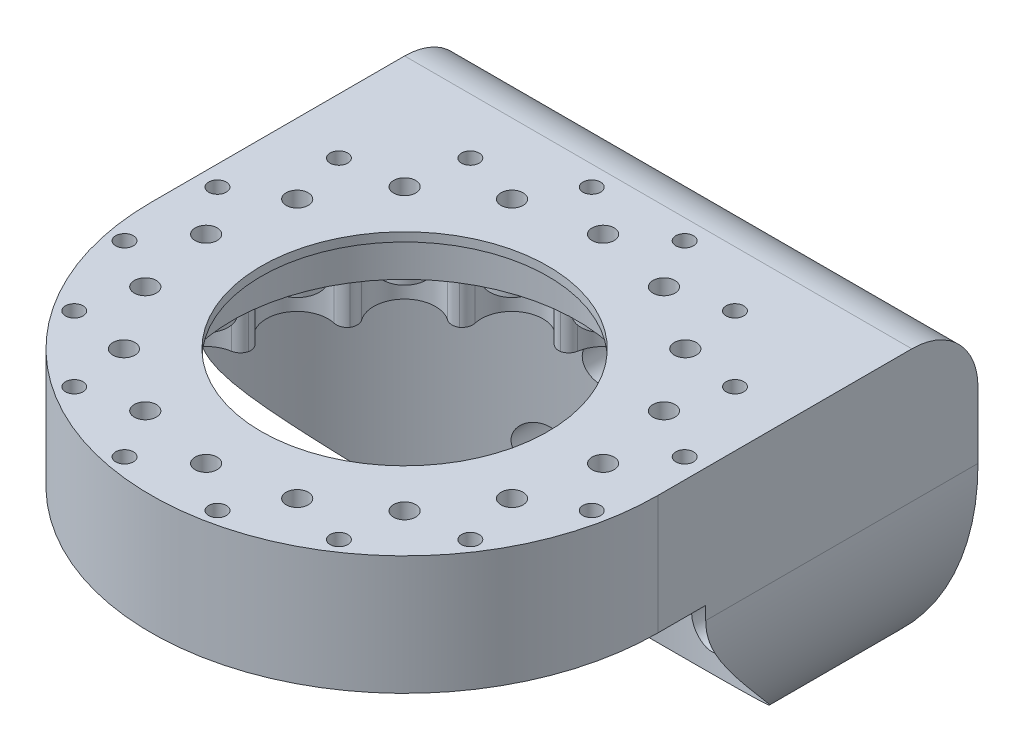
from build123d import *
from build123d.topology import SkipClean

# Parameters (mm, degrees)
SKETCH1_R           = 57.5
SKETCH1_R_2         = 39.1
SKETCH1_R_3         = 2
BOSS_EXTRUDE1_DEPTH = 14
SKETCH2_R           = 2.5
CUT_EXTRUDE1_DEPTH  = 40
SKETCH4_R           = 5
SKETCH4_R_2         = 2.5
BOSS_EXTRUDE3_DEPTH = 1.8
BOSS_EXTRUDE4_START = 13
SKETCH5_R           = 57.5
SKETCH5_R_2         = 2
BOSS_EXTRUDE4_DEPTH = 13
FILLET2_R           = 2.5
BOSS_EXTRUDE7_DEPTH = 27
BOSS_EXTRUDE8_DEPTH = 115
CUT_EXTRUDE2_START  = -60.5
SKETCH8_R           = 58.5
CUT_EXTRUDE2_DEPTH  = 60.5
SKETCH9_R           = 2.25
CUT_EXTRUDE3_DEPTH  = 67.5
SKETCH10_R          = 4.5
CUT_EXTRUDE4_DEPTH  = 62.5
CUT_EXTRUDE5_DEPTH  = 133
FILLET4_R           = 15
BOSS_EXTRUDE9_START = -2
SKETCH12_R          = 39.1
SKETCH12_R_2        = 32.5
BOSS_EXTRUDE9_DEPTH = 2


with BuildPart() as part:
    # Sketch1 → Boss-Extrude1 (new body)
    with BuildSketch(Plane(origin=(0, 0, 0), x_dir=(1, 0, 0), z_dir=(0, 1, 0))):
        with Locations(Location((0, 0, 0), (0, 0, 270))):
            Circle(SKETCH1_R)
        with Locations(Location((0, 0, 0), (0, 0, 270))):
            Circle(SKETCH1_R_2, mode=Mode.SUBTRACT)
        with Locations(Location((-10.534877389, 52.962405142, 0), (0, 0, 270))):
            Circle(SKETCH1_R_3, mode=Mode.SUBTRACT)
        with Locations(Location((10.534877389, 52.962405142, 0), (0, 0, 270))):
            Circle(SKETCH1_R_3, mode=Mode.SUBTRACT)
        with Locations(Location((30.000792583, 44.899359064, 0), (0, 0, 270))):
            Circle(SKETCH1_R_3, mode=Mode.SUBTRACT)
        with Locations(Location((44.899359064, 30.000792583, 0), (0, 0, 270))):
            Circle(SKETCH1_R_3, mode=Mode.SUBTRACT)
        with Locations(Location((52.962405142, 10.534877389, 0), (0, 0, 270))):
            Circle(SKETCH1_R_3, mode=Mode.SUBTRACT)
        with Locations(Location((52.962405142, -10.534877389, 0), (0, 0, 270))):
            Circle(SKETCH1_R_3, mode=Mode.SUBTRACT)
        with Locations(Location((44.899359064, -30.000792583, 0), (0, 0, 270))):
            Circle(SKETCH1_R_3, mode=Mode.SUBTRACT)
        with Locations(Location((30.000792583, -44.899359064, 0), (0, 0, 270))):
            Circle(SKETCH1_R_3, mode=Mode.SUBTRACT)
        with Locations(Location((10.534877389, -52.962405142, 0), (0, 0, 270))):
            Circle(SKETCH1_R_3, mode=Mode.SUBTRACT)
        with Locations(Location((-10.534877389, -52.962405142, 0), (0, 0, 270))):
            Circle(SKETCH1_R_3, mode=Mode.SUBTRACT)
        with Locations(Location((-30.000792583, -44.899359064, 0), (0, 0, 270))):
            Circle(SKETCH1_R_3, mode=Mode.SUBTRACT)
        with Locations(Location((-44.899359064, -30.000792583, 0), (0, 0, 270))):
            Circle(SKETCH1_R_3, mode=Mode.SUBTRACT)
        with Locations(Location((-52.962405142, -10.534877389, 0), (0, 0, 270))):
            Circle(SKETCH1_R_3, mode=Mode.SUBTRACT)
        with Locations(Location((-52.962405142, 10.534877389, 0), (0, 0, 270))):
            Circle(SKETCH1_R_3, mode=Mode.SUBTRACT)
        with Locations(Location((-44.899359064, 30.000792583, 0), (0, 0, 270))):
            Circle(SKETCH1_R_3, mode=Mode.SUBTRACT)
        with Locations(Location((-30.000792583, 44.899359064, 0), (0, 0, 270))):
            Circle(SKETCH1_R_3, mode=Mode.SUBTRACT)
    extrude(amount=BOSS_EXTRUDE1_DEPTH)

    # Sketch2 → Cut-Extrude1 (cut)
    with BuildSketch(Plane(origin=(0, 14, 0), x_dir=(1, 0, 0), z_dir=(0, 1, 0))):
        with Locations(Location((0, 45, 0), (0, 0, 270))):
            Circle(SKETCH2_R)
        with Locations(Location((17.220754456, 41.574578963, 0), (0, 0, 270))):
            Circle(SKETCH2_R)
        with Locations(Location((31.819805153, 31.819805153, 0), (0, 0, 270))):
            Circle(SKETCH2_R)
        with Locations(Location((41.574578963, 17.220754456, 0), (0, 0, 270))):
            Circle(SKETCH2_R)
        with Locations(Location((45, 0, 0), (0, 0, 270))):
            Circle(SKETCH2_R)
        with Locations(Location((41.574578963, -17.220754456, 0), (0, 0, 270))):
            Circle(SKETCH2_R)
        with Locations(Location((31.819805153, -31.819805153, 0), (0, 0, 270))):
            Circle(SKETCH2_R)
        with Locations(Location((17.220754456, -41.574578963, 0), (0, 0, 270))):
            Circle(SKETCH2_R)
        with Locations(Location((0, -45, 0), (0, 0, 270))):
            Circle(SKETCH2_R)
        with Locations(Location((-17.220754456, -41.574578963, 0), (0, 0, 270))):
            Circle(SKETCH2_R)
        with Locations(Location((-31.819805153, -31.819805153, 0), (0, 0, 270))):
            Circle(SKETCH2_R)
        with Locations(Location((-41.574578963, -17.220754456, 0), (0, 0, 270))):
            Circle(SKETCH2_R)
        with Locations(Location((-45, 0, 0), (0, 0, 270))):
            Circle(SKETCH2_R)
        with Locations(Location((-41.574578963, 17.220754456, 0), (0, 0, 270))):
            Circle(SKETCH2_R)
        with Locations(Location((-31.819805153, 31.819805153, 0), (0, 0, 270))):
            Circle(SKETCH2_R)
        with Locations(Location((-17.220754456, 41.574578963, 0), (0, 0, 270))):
            Circle(SKETCH2_R)
    extrude(amount=-CUT_EXTRUDE1_DEPTH, mode=Mode.SUBTRACT)

    # Sketch4 → Boss-Extrude3 (add)
    # profile 1 of 16: a face of its own
    with BuildSketch(Plane(origin=(0, 0, 0), x_dir=(1, 0, 0), z_dir=(0, 1, 0))):
        with Locations(Location((0, 45, 0), (0, 0, 270))):
            Circle(SKETCH4_R)
        with Locations(Location((0, 45, 0), (0, 0, 270))):
            Circle(SKETCH4_R_2, mode=Mode.SUBTRACT)
    # profile 2 of 16: a face of its own
    with BuildSketch(Plane(origin=(0, 0, 0), x_dir=(1, 0, 0), z_dir=(0, 1, 0))):
        with Locations(Location((17.220754456, 41.574578963, 0), (0, 0, 270))):
            Circle(SKETCH4_R)
        with Locations(Location((17.220754456, 41.574578963, 0), (0, 0, 270))):
            Circle(SKETCH4_R_2, mode=Mode.SUBTRACT)
    # profile 3 of 16: a face of its own
    with BuildSketch(Plane(origin=(0, 0, 0), x_dir=(1, 0, 0), z_dir=(0, 1, 0))):
        with Locations(Location((31.819805153, 31.819805153, 0), (0, 0, 270))):
            Circle(SKETCH4_R)
        with Locations(Location((31.819805153, 31.819805153, 0), (0, 0, 270))):
            Circle(SKETCH4_R_2, mode=Mode.SUBTRACT)
    # profile 4 of 16: a face of its own
    with BuildSketch(Plane(origin=(0, 0, 0), x_dir=(1, 0, 0), z_dir=(0, 1, 0))):
        with Locations(Location((41.574578963, 17.220754456, 0), (0, 0, 270))):
            Circle(SKETCH4_R)
        with Locations(Location((41.574578963, 17.220754456, 0), (0, 0, 270))):
            Circle(SKETCH4_R_2, mode=Mode.SUBTRACT)
    # profile 5 of 16: a face of its own
    with BuildSketch(Plane(origin=(0, 0, 0), x_dir=(1, 0, 0), z_dir=(0, 1, 0))):
        with Locations(Location((45, 0, 0), (0, 0, 270))):
            Circle(SKETCH4_R)
        with Locations(Location((45, 0, 0), (0, 0, 270))):
            Circle(SKETCH4_R_2, mode=Mode.SUBTRACT)
    # profile 6 of 16: a face of its own
    with BuildSketch(Plane(origin=(0, 0, 0), x_dir=(1, 0, 0), z_dir=(0, 1, 0))):
        with Locations(Location((41.574578963, -17.220754456, 0), (0, 0, 270))):
            Circle(SKETCH4_R)
        with Locations(Location((41.574578963, -17.220754456, 0), (0, 0, 270))):
            Circle(SKETCH4_R_2, mode=Mode.SUBTRACT)
    # profile 7 of 16: a face of its own
    with BuildSketch(Plane(origin=(0, 0, 0), x_dir=(1, 0, 0), z_dir=(0, 1, 0))):
        with Locations(Location((31.819805153, -31.819805153, 0), (0, 0, 270))):
            Circle(SKETCH4_R)
        with Locations(Location((31.819805153, -31.819805153, 0), (0, 0, 270))):
            Circle(SKETCH4_R_2, mode=Mode.SUBTRACT)
    # profile 8 of 16: a face of its own
    with BuildSketch(Plane(origin=(0, 0, 0), x_dir=(1, 0, 0), z_dir=(0, 1, 0))):
        with Locations(Location((17.220754456, -41.574578963, 0), (0, 0, 270))):
            Circle(SKETCH4_R)
        with Locations(Location((17.220754456, -41.574578963, 0), (0, 0, 270))):
            Circle(SKETCH4_R_2, mode=Mode.SUBTRACT)
    # profile 9 of 16: a face of its own
    with BuildSketch(Plane(origin=(0, 0, 0), x_dir=(1, 0, 0), z_dir=(0, 1, 0))):
        with Locations(Location((0, -45, 0), (0, 0, 270))):
            Circle(SKETCH4_R)
        with Locations(Location((0, -45, 0), (0, 0, 270))):
            Circle(SKETCH4_R_2, mode=Mode.SUBTRACT)
    # profile 10 of 16: a face of its own
    with BuildSketch(Plane(origin=(0, 0, 0), x_dir=(1, 0, 0), z_dir=(0, 1, 0))):
        with Locations(Location((-17.220754456, -41.574578963, 0), (0, 0, 270))):
            Circle(SKETCH4_R)
        with Locations(Location((-17.220754456, -41.574578963, 0), (0, 0, 270))):
            Circle(SKETCH4_R_2, mode=Mode.SUBTRACT)
    # profile 11 of 16: a face of its own
    with BuildSketch(Plane(origin=(0, 0, 0), x_dir=(1, 0, 0), z_dir=(0, 1, 0))):
        with Locations(Location((-31.819805153, -31.819805153, 0), (0, 0, 270))):
            Circle(SKETCH4_R)
        with Locations(Location((-31.819805153, -31.819805153, 0), (0, 0, 270))):
            Circle(SKETCH4_R_2, mode=Mode.SUBTRACT)
    # profile 12 of 16: a face of its own
    with BuildSketch(Plane(origin=(0, 0, 0), x_dir=(1, 0, 0), z_dir=(0, 1, 0))):
        with Locations(Location((-41.574578963, -17.220754456, 0), (0, 0, 270))):
            Circle(SKETCH4_R)
        with Locations(Location((-41.574578963, -17.220754456, 0), (0, 0, 270))):
            Circle(SKETCH4_R_2, mode=Mode.SUBTRACT)
    # profile 13 of 16: a face of its own
    with BuildSketch(Plane(origin=(0, 0, 0), x_dir=(1, 0, 0), z_dir=(0, 1, 0))):
        with Locations(Location((-45, 0, 0), (0, 0, 270))):
            Circle(SKETCH4_R)
        with Locations(Location((-45, 0, 0), (0, 0, 270))):
            Circle(SKETCH4_R_2, mode=Mode.SUBTRACT)
    # profile 14 of 16: a face of its own
    with BuildSketch(Plane(origin=(0, 0, 0), x_dir=(1, 0, 0), z_dir=(0, 1, 0))):
        with Locations(Location((-41.574578963, 17.220754456, 0), (0, 0, 270))):
            Circle(SKETCH4_R)
        with Locations(Location((-41.574578963, 17.220754456, 0), (0, 0, 270))):
            Circle(SKETCH4_R_2, mode=Mode.SUBTRACT)
    # profile 15 of 16: a face of its own
    with BuildSketch(Plane(origin=(0, 0, 0), x_dir=(1, 0, 0), z_dir=(0, 1, 0))):
        with Locations(Location((-31.819805153, 31.819805153, 0), (0, 0, 270))):
            Circle(SKETCH4_R)
        with Locations(Location((-31.819805153, 31.819805153, 0), (0, 0, 270))):
            Circle(SKETCH4_R_2, mode=Mode.SUBTRACT)
    # profile 16 of 16: a face of its own
    with BuildSketch(Plane(origin=(0, 0, 0), x_dir=(1, 0, 0), z_dir=(0, 1, 0))):
        with Locations(Location((-17.220754456, 41.574578963, 0), (0, 0, 270))):
            Circle(SKETCH4_R)
        with Locations(Location((-17.220754456, 41.574578963, 0), (0, 0, 270))):
            Circle(SKETCH4_R_2, mode=Mode.SUBTRACT)
    extrude(amount=-BOSS_EXTRUDE3_DEPTH)

    # Sketch5 → Boss-Extrude4 (add)
    with BuildSketch(Plane.XZ.offset(BOSS_EXTRUDE4_START)):
        with Locations(Location((0, 0, 0), (0, 0, 270))):
            Circle(SKETCH5_R)
        with Locations(Location((-30.000792583, -44.899359064, 0), (0, 0, 270))):
            Circle(SKETCH5_R_2, mode=Mode.SUBTRACT)
        with Locations(Location((-44.899359064, -30.000792583, 0), (0, 0, 270))):
            Circle(SKETCH5_R_2, mode=Mode.SUBTRACT)
        with Locations(Location((-10.534877389, -52.962405142, 0), (0, 0, 270))):
            Circle(SKETCH5_R_2, mode=Mode.SUBTRACT)
        with Locations(Location((-52.962405142, -10.534877389, 0), (0, 0, 270))):
            Circle(SKETCH5_R_2, mode=Mode.SUBTRACT)
        with Locations(Location((10.534877389, -52.962405142, 0), (0, 0, 270))):
            Circle(SKETCH5_R_2, mode=Mode.SUBTRACT)
        with Locations(Location((30.000792583, -44.899359064, 0), (0, 0, 270))):
            Circle(SKETCH5_R_2, mode=Mode.SUBTRACT)
        with Locations(Location((44.899359064, -30.000792583, 0), (0, 0, 270))):
            Circle(SKETCH5_R_2, mode=Mode.SUBTRACT)
        with BuildLine():
            ThreePointArc((43.742247125, 10.564838686), (44.135337618, 8.779064491), (44.455555556, 6.978795043))
            ThreePointArc((44.455555556, 6.978795043), (49.753361384, 5.138633627), (52, 0))
            ThreePointArc((52, 0), (49.753361384, -5.138633627), (44.455555556, -6.978795043))
            ThreePointArc((44.455555556, -6.978795043), (44.135337618, -8.779064491), (43.742247125, -10.564838686))
            ThreePointArc((43.742247125, -10.564838686), (47.23910353, -13.108193036), (48.574578963, -17.220754456))
            ThreePointArc((48.574578963, -17.220754456), (45.234108152, -23.187985482), (38.400908644, -23.459970489))
            ThreePointArc((38.400908644, -23.459970489), (37.416132554, -25.000660486), (36.369578094, -26.500071496))
            ThreePointArc((36.369578094, -26.500071496), (38.177808401, -28.89135937), (38.819805153, -31.819805153))
            ThreePointArc((38.819805153, -31.819805153), (34.244868492, -38.386316236), (26.500071496, -36.369578094))
            ThreePointArc((26.500071496, -36.369578094), (25.000660486, -37.416132554), (23.459970489, -38.400908644))
            ThreePointArc((23.459970489, -38.400908644), (24.027901885, -39.942787345), (24.220754456, -41.574578963))
            ThreePointArc((24.220754456, -41.574578963), (18.318158122, -48.488022764), (10.564838686, -43.742247125))
            ThreePointArc((10.564838686, -43.742247125), (8.779064491, -44.135337618), (6.978795043, -44.455555556))
            ThreePointArc((6.978795043, -44.455555556), (6.994696752, -44.727571384), (7, -45))
            ThreePointArc((7, -45), (-0.272428616, -51.994696752), (-6.978795043, -44.455555556))
            ThreePointArc((-6.978795043, -44.455555556), (-8.779064491, -44.135337618), (-10.564838686, -43.742247125))
            ThreePointArc((-10.564838686, -43.742247125), (-19.899538483, -48.041735691), (-23.459970489, -38.400908644))
            ThreePointArc((-23.459970489, -38.400908644), (-25.000660486, -37.416132554), (-26.500071496, -36.369578094))
            ThreePointArc((-26.500071496, -36.369578094), (-36.769552622, -36.769552622), (-36.369578094, -26.500071496))
            ThreePointArc((-36.369578094, -26.500071496), (-37.416132554, -25.000660486), (-38.400908644, -23.459970489))
            ThreePointArc((-38.400908644, -23.459970489), (-48.041735691, -19.899538483), (-43.742247125, -10.564838686))
            ThreePointArc((-43.742247125, -10.564838686), (-44.135337618, -8.779064491), (-44.455555556, -6.978795043))
            ThreePointArc((-44.455555556, -6.978795043), (-52, 0), (-44.455555556, 6.978795043))
            ThreePointArc((-44.455555556, 6.978795043), (-44.135337618, 8.779064491), (-43.742247125, 10.564838686))
            ThreePointArc((-43.742247125, 10.564838686), (-48.041735691, 19.899538483), (-38.400908644, 23.459970489))
            ThreePointArc((-38.400908644, 23.459970489), (-37.416132554, 25.000660486), (-36.369578094, 26.500071496))
            ThreePointArc((-36.369578094, 26.500071496), (-36.769552622, 36.769552622), (-26.500071496, 36.369578094))
            ThreePointArc((-26.500071496, 36.369578094), (-25.000660486, 37.416132554), (-23.459970489, 38.400908644))
            ThreePointArc((-23.459970489, 38.400908644), (-19.899538483, 48.041735691), (-10.564838686, 43.742247125))
            ThreePointArc((-10.564838686, 43.742247125), (-8.779064491, 44.135337618), (-6.978795043, 44.455555556))
            ThreePointArc((-6.978795043, 44.455555556), (-0.272428616, 51.994696752), (7, 45))
            ThreePointArc((7, 45), (6.994696752, 44.727571384), (6.978795043, 44.455555556))
            ThreePointArc((6.978795043, 44.455555556), (8.779064491, 44.135337618), (10.564838686, 43.742247125))
            ThreePointArc((10.564838686, 43.742247125), (18.318158122, 48.488022764), (24.220754456, 41.574578963))
            ThreePointArc((24.220754456, 41.574578963), (24.027901885, 39.942787345), (23.459970489, 38.400908644))
            ThreePointArc((23.459970489, 38.400908644), (25.000660486, 37.416132554), (26.500071496, 36.369578094))
            ThreePointArc((26.500071496, 36.369578094), (34.244868492, 38.386316236), (38.819805153, 31.819805153))
            ThreePointArc((38.819805153, 31.819805153), (38.177808401, 28.89135937), (36.369578094, 26.500071496))
            ThreePointArc((36.369578094, 26.500071496), (37.416132554, 25.000660486), (38.400908644, 23.459970489))
            ThreePointArc((38.400908644, 23.459970489), (45.234108152, 23.187985482), (48.574578963, 17.220754456))
            ThreePointArc((48.574578963, 17.220754456), (47.23910353, 13.108193036), (43.742247125, 10.564838686))
        make_face(mode=Mode.SUBTRACT)
        with Locations(Location((52.962405142, -10.534877389, 0), (0, 0, 270))):
            Circle(SKETCH5_R_2, mode=Mode.SUBTRACT)
        with Locations(Location((-52.962405142, 10.534877389, 0), (0, 0, 270))):
            Circle(SKETCH5_R_2, mode=Mode.SUBTRACT)
        with Locations(Location((-44.899359064, 30.000792583, 0), (0, 0, 270))):
            Circle(SKETCH5_R_2, mode=Mode.SUBTRACT)
        with Locations(Location((-30.000792583, 44.899359064, 0), (0, 0, 270))):
            Circle(SKETCH5_R_2, mode=Mode.SUBTRACT)
        with Locations(Location((-10.534877389, 52.962405142, 0), (0, 0, 270))):
            Circle(SKETCH5_R_2, mode=Mode.SUBTRACT)
        with Locations(Location((52.962405142, 10.534877389, 0), (0, 0, 270))):
            Circle(SKETCH5_R_2, mode=Mode.SUBTRACT)
        with Locations(Location((10.534877389, 52.962405142, 0), (0, 0, 270))):
            Circle(SKETCH5_R_2, mode=Mode.SUBTRACT)
        with Locations(Location((44.899359064, 30.000792583, 0), (0, 0, 270))):
            Circle(SKETCH5_R_2, mode=Mode.SUBTRACT)
        with Locations(Location((30.000792583, 44.899359064, 0), (0, 0, 270))):
            Circle(SKETCH5_R_2, mode=Mode.SUBTRACT)
    extrude(amount=-BOSS_EXTRUDE4_DEPTH)

    # Fillet2
    # the kernel refuses this fillet: 2.5 mm, written as the material it takes off along each edge
    with BuildSketch(Plane(origin=(-23.459970489, -17.820377086, -38.400908644), x_dir=(-0.3417635000019396, 0, -0.9397859916312991), z_dir=(0, 1, 0)), Plane(origin=(-6.978795043, -17.820377086, -44.455555556), x_dir=(0.043892226354758646, 0, -0.9990362718468347), z_dir=(0, 1, 0)), Plane(origin=(10.564838686, -17.820377086, -43.742247125), x_dir=(0.42286575913303964, 0, -0.9061923359601086), z_dir=(0, 1, 0)), Plane(origin=(26.500071496, -17.820377086, -36.369578094), x_dir=(0.7374618133709678, 0, -0.6753888315774875), z_dir=(0, 1, 0)), Plane(origin=(38.400908644, -17.820377086, -23.459970489), x_dir=(0.9397859916312004, 0, -0.341763500002211), z_dir=(0, 1, 0)), Plane(origin=(44.455555556, -17.820377086, -6.978795043), x_dir=(0.9990362718468425, 0, 0.04389222635458014), z_dir=(0, 1, 0)), Plane(origin=(43.742247125, -17.820377086, 10.564838686), x_dir=(0.906192335960156, 0, 0.4228657591329378), z_dir=(0, 1, 0)), Plane(origin=(-43.742247125, -17.820377086, -10.564838686), x_dir=(-0.906192335959984, 0, -0.4228657591333062), z_dir=(0, 1, 0)), Plane(origin=(-44.455555556, -17.820377086, 6.978795043), x_dir=(-0.9990362718468232, 0, -0.04389222635502207), z_dir=(0, 1, 0)), Plane(origin=(-38.400908644, -17.820377086, 23.459970489), x_dir=(-0.9397859916313415, 0, 0.34176350000182304), z_dir=(0, 1, 0)), Plane(origin=(-26.500071496, -17.820377086, 36.369578094), x_dir=(-0.7374618133711829, 0, 0.6753888315772527), z_dir=(0, 1, 0)), Plane(origin=(-10.564838686, -17.820377086, 43.742247125), x_dir=(-0.4228657591331182, 0, 0.9061923359600719), z_dir=(0, 1, 0)), Plane(origin=(6.978795043, -17.820377086, 44.455555556), x_dir=(-0.04389222635481192, 0, 0.9990362718468324), z_dir=(0, 1, 0)), Plane(origin=(23.459970489, -17.820377086, 38.400908644), x_dir=(0.34176350000200806, 0, 0.9397859916312743), z_dir=(0, 1, 0)), Plane(origin=(36.369578094, -17.820377086, 26.500071496), x_dir=(0.6753888315774799, 0, 0.7374618133709748), z_dir=(0, 1, 0))) as fillet2_piece_1:
        with BuildLine():
            CenterArc((2.004124414, 2.481490179), FILLET2_R, 193.892520635, 69.130988159)
            ThreePointArc((-0.422745168, 1.881236871), (-0.201295571, 0.942882908), (0, 0))
            ThreePointArc((0, 0), (0.8502346, 0.051827497), (1.700469199, 0))
        make_face()
    extrude(amount=17.820377086, mode=Mode.SUBTRACT)
    with BuildSketch(Plane(origin=(-10.564838686, -17.820377086, -43.742247125), x_dir=(0.9768566115091916, 0, -0.21389520927496325), z_dir=(0, 1, 0)), Plane(origin=(-26.500071496, -17.820377086, -36.369578094), x_dir=(0.8206436767198755, 0, -0.5714402469722311), z_dir=(0, 1, 0)), Plane(origin=(6.978795043, -17.820377086, -44.455555556), x_dir=(0.9843519824234629, 0, 0.17621343506951645), z_dir=(0, 1, 0)), Plane(origin=(23.459970489, -17.820377086, -38.400908644), x_dir=(0.8419886871867125, 0, 0.5394951813034075), z_dir=(0, 1, 0)), Plane(origin=(36.369578094, -17.820377086, -26.500071496), x_dir=(0.5714402469722466, 0, 0.8206436767198647), z_dir=(0, 1, 0)), Plane(origin=(43.742247125, -17.820377086, -10.564838686), x_dir=(0.21389520927503133, 0, 0.9768566115091767), z_dir=(0, 1, 0)), Plane(origin=(44.455555556, -17.820377086, 6.978795043), x_dir=(-0.176213435069412, 0, 0.9843519824234815), z_dir=(0, 1, 0)), Plane(origin=(38.400908644, -17.820377086, 23.459970489), x_dir=(-0.5394951813033152, 0, 0.8419886871867717), z_dir=(0, 1, 0)), Plane(origin=(-38.400908644, -17.820377086, -23.459970489), x_dir=(0.5394951813033921, 0, -0.8419886871867223), z_dir=(0, 1, 0)), Plane(origin=(-44.455555556, -17.820377086, -6.978795043), x_dir=(0.17621343506945097, 0, -0.9843519824234747), z_dir=(0, 1, 0)), Plane(origin=(-43.742247125, -17.820377086, 10.564838686), x_dir=(-0.21389520927505185, 0, -0.9768566115091721), z_dir=(0, 1, 0)), Plane(origin=(-36.369578094, -17.820377086, 26.500071496), x_dir=(-0.5714402469723276, 0, -0.8206436767198083), z_dir=(0, 1, 0)), Plane(origin=(-23.459970489, -17.820377086, 38.400908644), x_dir=(-0.8419886871868045, 0, -0.5394951813032637), z_dir=(0, 1, 0)), Plane(origin=(-6.978795043, -17.820377086, 44.455555556), x_dir=(-0.9843519824234938, 0, -0.17621343506934395), z_dir=(0, 1, 0)), Plane(origin=(10.564838686, -17.820377086, 43.742247125), x_dir=(-0.9768566115091561, 0, 0.21389520927512493), z_dir=(0, 1, 0)), Plane(origin=(26.500071496, -17.820377086, 36.369578094), x_dir=(-0.8206436767197927, 0, 0.57144024697235), z_dir=(0, 1, 0))) as fillet2_piece_2:
        with BuildLine():
            CenterArc((1.98171058, 2.499426205), FILLET2_R, 199.641418976, 69.130988159)
            ThreePointArc((-0.372826194, 1.659094972), (-0.135846618, 0.840910614), (0, 0))
            ThreePointArc((0, 0), (0.964075417, 0.010328312), (1.928150834, 0))
        make_face()
    extrude(amount=17.820377086, mode=Mode.SUBTRACT)
    with BuildSketch(Plane(origin=(-36.369578094, -17.820377086, -26.500071496), x_dir=(-0.571440246972356, 0, 0.8206436767197886), z_dir=(0, 1, 0))) as fillet2_piece_3:
        with BuildLine():
            CenterArc((1.98171058, -2.499426205), FILLET2_R, 91.227592865, 69.130988159)
            ThreePointArc((-0.372826194, -1.659094972), (-0.135846618, -0.840910614), (0, 0))
            ThreePointArc((0, 0), (0.964075417, -0.010328312), (1.928150834, 0))
        make_face()
    extrude(amount=17.820377086, mode=Mode.SUBTRACT)

    # Sketch6 → Boss-Extrude7 (add)
    with BuildSketch(Plane.XZ.offset(13)):
        with BuildLine():
            Line((57.5, -57.5), (57.5, 0))
            ThreePointArc((57.5, 0), (40.658639918, -40.658639918), (0, -57.5))
            Line((0, -57.5), (57.5, -57.5))
        make_face()
        with BuildLine():
            Line((-57.5, -57.5), (0, -57.5))
            ThreePointArc((0, -57.5), (-40.658639918, -40.658639918), (-57.5, 0))
            Line((-57.5, 0), (-57.5, -57.5))
        make_face()
    extrude(amount=-BOSS_EXTRUDE7_DEPTH)

    # Sketch7 → Boss-Extrude8 (add)
    with SkipClean():  # the faces are left unmerged after this step: merging them gives an invalid solid
        with BuildSketch(Plane.ZY.offset(57.5)):
            Polygon((-57.5, -13), (-57.5, 14), (-72.5, 14), (-72.5, -73.5), (-57.5, -73.5), align=None)
            Polygon((0, -13), (-57.5, -13), (-57.5, -73.5), align=None)
        extrude(amount=-BOSS_EXTRUDE8_DEPTH)
    add(part.part.scale(1), mode=Mode.REPLACE)  # the faces are merged on a copy

    # Sketch8 → Cut-Extrude2 (cut)
    with BuildSketch(Plane.XZ.offset(73.5).offset(CUT_EXTRUDE2_START)):
        Circle(SKETCH8_R)
    extrude(amount=CUT_EXTRUDE2_DEPTH, mode=Mode.SUBTRACT)

    # Sketch9 → Cut-Extrude3 (cut)
    with BuildSketch(Plane(origin=(0, 0, -72.5), x_dir=(-1, 0, 0), z_dir=(0, 0, -1))):
        with Locations((23, -43.5)):
            Circle(SKETCH9_R)
        with Locations((11.5, -63.418584287)):
            Circle(SKETCH9_R)
        with Locations((-11.5, -63.418584287)):
            Circle(SKETCH9_R)
        with Locations((-23, -43.5)):
            Circle(SKETCH9_R)
        with Locations((-11.5, -23.581415713)):
            Circle(SKETCH9_R)
        with Locations((11.5, -23.581415713)):
            Circle(SKETCH9_R)
    extrude(amount=-CUT_EXTRUDE3_DEPTH, mode=Mode.SUBTRACT)

    # Sketch10 → Cut-Extrude4 (cut)
    with BuildSketch(Plane.XY):
        with Locations((23, -43.5)):
            Circle(SKETCH10_R)
        with Locations((11.5, -63.418584287)):
            Circle(SKETCH10_R)
        with Locations((-11.5, -63.418584287)):
            Circle(SKETCH10_R)
        with Locations((-23, -43.5)):
            Circle(SKETCH10_R)
        with Locations((-11.5, -23.581415713)):
            Circle(SKETCH10_R)
        with Locations((11.5, -23.581415713)):
            Circle(SKETCH10_R)
    extrude(amount=-CUT_EXTRUDE4_DEPTH, mode=Mode.SUBTRACT)

    # Sketch11 → Cut-Extrude5 (cut)
    with BuildSketch(Plane(origin=(0, 0, -72.5), x_dir=(-1, 0, 0), z_dir=(0, 0, -1))):
        with BuildLine():
            ThreePointArc((1.04e-07, -73.5), (-40.658639882, -56.658639955), (-57.5, -16))
            Line((-57.5, -16), (-57.5, -73.5))
            Line((-57.5, -73.5), (1.04e-07, -73.5))
        make_face()
        with BuildLine():
            Line((57.5, -20.06), (57.5, -16))
            ThreePointArc((57.5, -16), (40.658639955, -56.658639882), (1.04e-07, -73.5))
            Line((1.04e-07, -73.5), (57.5, -73.5))
            Line((57.5, -73.5), (57.5, -20.06))
        make_face()
    extrude(amount=-CUT_EXTRUDE5_DEPTH, mode=Mode.SUBTRACT)

    # Fillet4
    fillet4_edges = [part.edges().sort_by_distance(p)[0] for p in [
        (0, 14, -72.5),
    ]]
    fillet(fillet4_edges, radius=FILLET4_R)

    # Sketch12 → Boss-Extrude9 (add)
    with BuildSketch(Plane(origin=(0, 14, 0), x_dir=(1, 0, 0), z_dir=(0, 1, 0)).offset(BOSS_EXTRUDE9_START)):
        with Locations(Location((0, 0, 0), (0, 0, 270))):
            Circle(SKETCH12_R)
        with Locations(Location((0, 0, 0), (0, 0, 270))):
            Circle(SKETCH12_R_2, mode=Mode.SUBTRACT)
    extrude(amount=BOSS_EXTRUDE9_DEPTH)


solid = part.part
